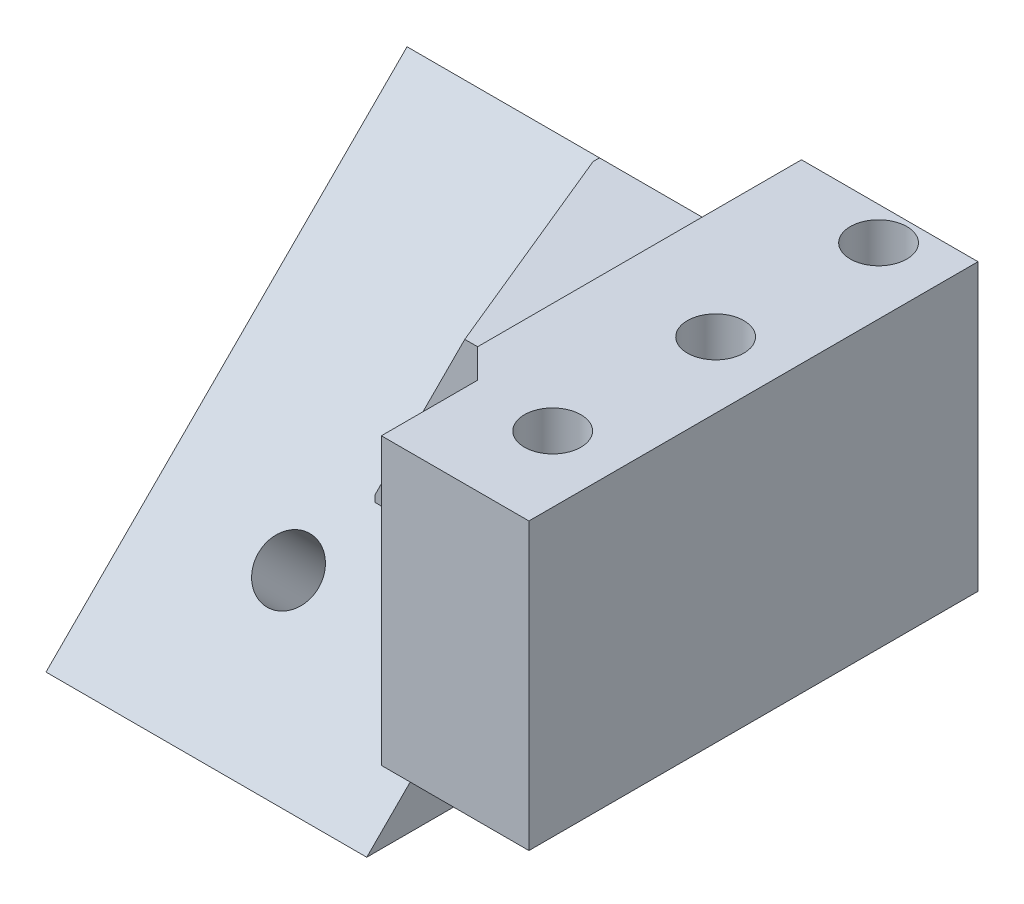
from build123d import *

# Parameters (mm, degrees)
SKETCH1_W               = 35
SKETCH1_H               = 22.25
BOSS_EXTRUDE1_DEPTH     = 11.5
SKETCH2_R               = 2.2
CUT_EXTRUDE1_DEPTH      = 31.554255023
LPATTERN1_COUNT         = 3
LPATTERN1_PITCH         = 12.7
SKETCH3_W               = 17.5
SKETCH3_H               = 14.50834553
BOSS_EXTRUDE2_DEPTH     = 18
CHAMFER1_SIZE           = 10
BOSS_EXTRUDE3_DEPTH     = 15
BOSS_EXTRUDE4_DEPTH     = 10
CHAMFER2_SIZE           = 7
SKETCH10_R              = 2.35
CUT_EXTRUDE6_DEPTH      = 17
CUT_EXTRUDE7_DEPTH      = 16
CUT_EXTRUDE7_DEPTH_BACK = 4
SKETCH12_R              = 4.2
CHAMFER3_START          = -7.072243188
CHAMFER3_DEPTH          = 22.731839604


with BuildPart() as part:
    # Sketch1 → Boss-Extrude1 (new body)
    with BuildSketch(Plane(origin=(0, 0, 0), x_dir=(0, 0, -1), z_dir=(1, 0, 0))):
        Rectangle(SKETCH1_W, SKETCH1_H)
    extrude(amount=BOSS_EXTRUDE1_DEPTH)

    # Sketch2 → Cut-Extrude1 (cut, through all)
    with BuildSketch(Plane(origin=(0, 11.125, 0), x_dir=(1, 0, 0), z_dir=(0, 1, 0))):
        with Locations(Location((6.35, -10.5, 0), (0, 0, 270))):
            Circle(SKETCH2_R)
    cut_extrude1 = extrude(amount=-CUT_EXTRUDE1_DEPTH, mode=Mode.SUBTRACT)

    # LPattern1: Cut-Extrude1 ×3
    with Locations(*[(0, 0, -i * LPATTERN1_PITCH) for i in range(1, LPATTERN1_COUNT)]):
        add(cut_extrude1, mode=Mode.SUBTRACT)

    # Sketch3 → Boss-Extrude2 (add)
    with BuildSketch(Plane.ZY):
        with Locations((-8.75, -3.870827235)):
            Rectangle(SKETCH3_W, SKETCH3_H)
    extrude(amount=BOSS_EXTRUDE2_DEPTH)

    # Chamfer1
    # the kernel refuses this chamfer: 10 mm, written as the material it adds along each edge
    with BuildSketch(Plane(origin=(0, 3.38334553, 0), x_dir=(0, 0, 1), z_dir=(0, -1, 0))) as chamfer1_piece_1:
        Polygon((CHAMFER1_SIZE, 0), (0, CHAMFER1_SIZE), (0, 0), align=None)
    extrude(amount=14.50834553)
    with BuildSketch(Plane(origin=(0, 3.38334553, -17.5), x_dir=(0, 1, 0), z_dir=(0, 0, 1))) as chamfer1_piece_2_section:
        Polygon((CHAMFER1_SIZE, 0), (0, CHAMFER1_SIZE), (0, 0), align=None)
    chamfer1_piece_2 = extrude(amount=17.5, mode=Mode.PRIVATE)
    chamfer1_piece_2 = split(chamfer1_piece_2, bisect_by=Plane(origin=(0, 11.125, -17.5), z_dir=(0, -1, 0)), keep=Keep.TOP, mode=Mode.PRIVATE)
    add(chamfer1_piece_2)
    with BuildSketch(Plane(origin=(0, 3.38334553, -17.5), x_dir=(0, 1, 0), z_dir=(0, 0, 1))) as chamfer1_piece_3a_section:
        Polygon((CHAMFER1_SIZE, 0), (0, CHAMFER1_SIZE), (0, 0), align=None)
    chamfer1_piece_3a = extrude(amount=43.21682988, mode=Mode.PRIVATE)
    chamfer1_piece_3a = split(chamfer1_piece_3a, bisect_by=Plane(origin=(0, 11.125, -17.5), z_dir=(0, -1, 0)), keep=Keep.TOP, mode=Mode.PRIVATE)
    chamfer1_piece_3a = split(chamfer1_piece_3a, bisect_by=Plane(origin=(0, 3.38334553, 17.5), z_dir=(0, 0, -1)), keep=Keep.TOP, mode=Mode.PRIVATE)
    chamfer1_piece_3a = split(chamfer1_piece_3a, bisect_by=Plane(origin=(0, 3.38334553, 0), z_dir=(0, 0, 1)), keep=Keep.TOP, mode=Mode.PRIVATE)
    with BuildSketch(Plane(origin=(0, 29.100175409, 0), x_dir=(0, 0, 1), z_dir=(0, -1, 0))) as chamfer1_piece_3b_section:
        Polygon((CHAMFER1_SIZE, 0), (0, CHAMFER1_SIZE), (0, 0), align=None)
    chamfer1_piece_3b = extrude(amount=40.225175409, mode=Mode.PRIVATE)
    chamfer1_piece_3b = split(chamfer1_piece_3b, bisect_by=Plane(origin=(0, 11.125, 0), z_dir=(0, -1, 0)), keep=Keep.TOP, mode=Mode.PRIVATE)
    chamfer1_piece_3b = split(chamfer1_piece_3b, bisect_by=Plane(origin=(0, 3.38334553, 0), z_dir=(0, 1, 0)), keep=Keep.TOP, mode=Mode.PRIVATE)
    chamfer1_piece_3 = chamfer1_piece_3a & chamfer1_piece_3b
    add(chamfer1_piece_3)

    # Sketch4 → Boss-Extrude3 (add)
    with BuildSketch(Plane.ZY.offset(18)):
        Polygon((-17.5, -11.125), (-17.5, 3.38334553), (10.639309948, -24.755964418), (-17.5, -24.755964418), (-17.5, -19.755964418), align=None)
    extrude(amount=BOSS_EXTRUDE3_DEPTH)

    # Sketch6 → Boss-Extrude4 (add)
    with BuildSketch(Plane(origin=(-18, 0, 0), x_dir=(0, 0, -1), z_dir=(1, 0, 0))):
        Polygon((17.5, -11.125), (17.5, -24.755964418), (-10.639309948, -24.755964418), (2.99165447, -11.125), align=None)
    extrude(amount=BOSS_EXTRUDE4_DEPTH)

    # Chamfer2
    chamfer2_edges = [part.edges().sort_by_distance(p)[0] for p in [
        (-8, -11.125, -10.245827235),
    ]]
    chamfer(chamfer2_edges, length=CHAMFER2_SIZE)

    # Sketch10 → Cut-Extrude6 (cut)
    with BuildSketch(Plane(origin=(0, -7.058327235, -7.058327235), x_dir=(1, 0, 0), z_dir=(0, 0.7071067811865477, 0.7071067811865475))):
        with Locations(Location((-22.257276658, -13.490437262, 0), (0, 0, 270))):
            Circle(SKETCH10_R)
    extrude(amount=-CUT_EXTRUDE6_DEPTH, mode=Mode.SUBTRACT)

    # Sketch12 → Cut-Extrude7 (cut, two sides: drawn at the far end of the back side and taken through both)
    with BuildSketch(Plane(origin=(0, -23.282012782, -13.732717015), x_dir=(-1, 0, 0), z_dir=(0, -0.8613286818189869, -0.5080481294877154)).offset(-CUT_EXTRUDE7_DEPTH_BACK)):
        with Locations((22.257276658, -6.958686238)):
            Circle(SKETCH12_R)
    extrude(amount=CUT_EXTRUDE7_DEPTH + CUT_EXTRUDE7_DEPTH_BACK, mode=Mode.SUBTRACT)

    # Chamfer3: read off the stored shape, not the designer's step
    # Chamfer3 outline → Chamfer3 (cut)
    with BuildSketch(Plane(origin=(0, 0, 0), x_dir=(1, 0, 0), z_dir=(0, 0.6357072528610996, -0.7719302356170498)).offset(CHAMFER3_START)):
        Polygon((-11, -2.611706712), (-18, 8.195316587), (-18, -4), (-10.100765054, -4), align=None)
    extrude(amount=CHAMFER3_DEPTH, mode=Mode.SUBTRACT)


solid = part.part
